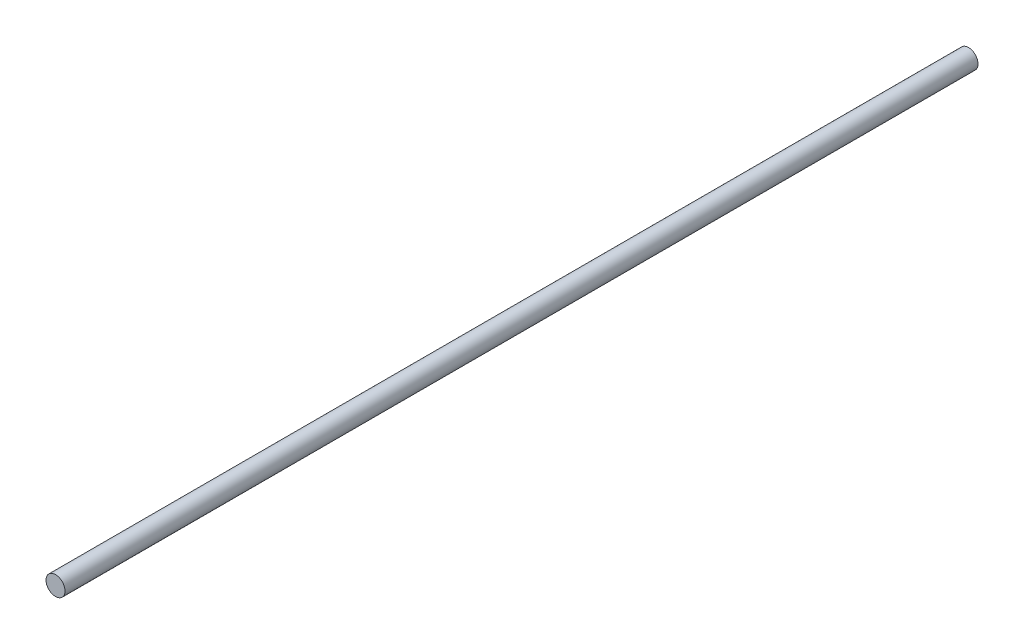
from build123d import *

# Parameters (mm, degrees)
SKETCH1_R           = 3.175
BOSS_EXTRUDE1_DEPTH = 304.8


with BuildPart() as part:
    # Sketch1 → Boss-Extrude1 (new body)
    with BuildSketch(Plane.XY):
        Circle(SKETCH1_R)
    extrude(amount=BOSS_EXTRUDE1_DEPTH)


solid = part.part
